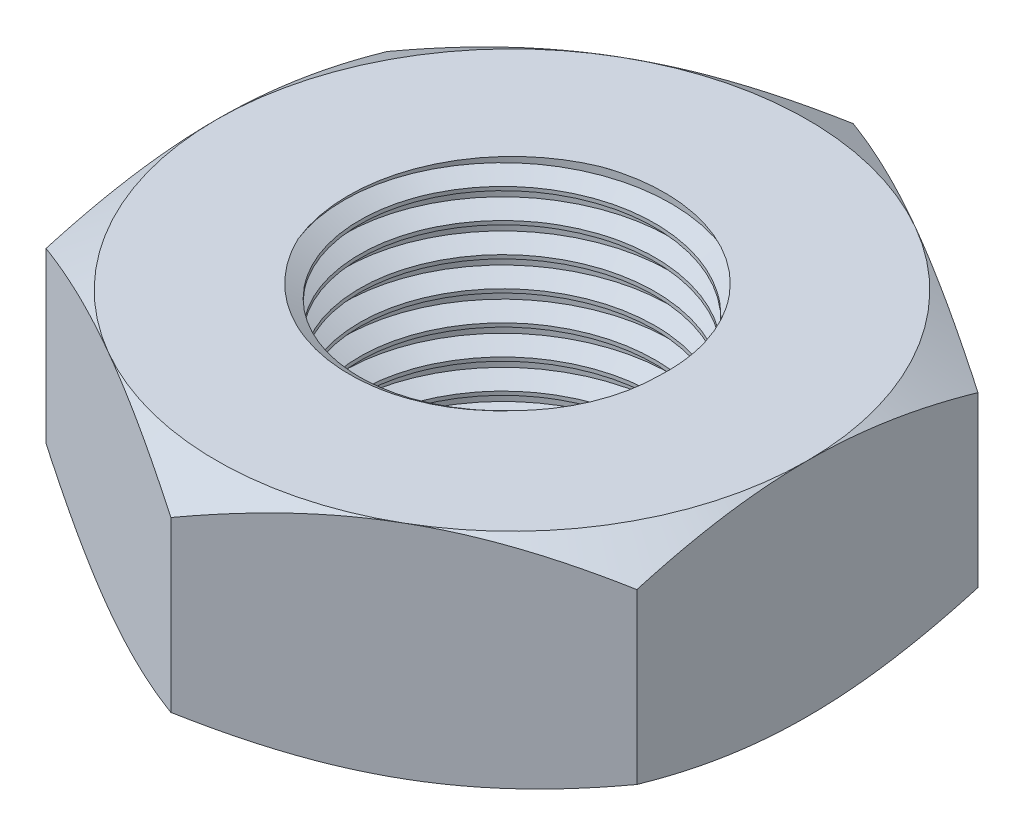
from build123d import *

# Parameters (mm, degrees)
SKETCH1_R                    = 10
BOSS_EXTRUDE1_DEPTH          = 7.5
THREAD1_PITCH                = 2
SKETCH5_OUTSIDE_W            = 175.946
SKETCH5_OUTSIDE_H            = 182.134
SKETCH5_OUTSIDE_R            = 20
CUT_EXTRUDE1_DEPTH           = 35.034296598
CUT_EXTRUDE1_TAPER           = 60
CUT_EXTRUDE1_OTHER_WAY_DEPTH = 35.034296598


with BuildPart() as part:
    # Sketch1 → Boss-Extrude1 (new, symmetric)
    with BuildSketch(Plane(origin=(0, 0, 0), x_dir=(1, 0, 0), z_dir=(0, 1, 0))):
        Polygon((0, 23.094010768), (-20, 11.547005384), (-20, -11.547005384), (0, -23.094010768), (20, -11.547005384), (20, 11.547005384), align=None)
        with Locations(Location((0, 0, 0), (0, 0, 270))):
            Circle(SKETCH1_R, mode=Mode.SUBTRACT)
    extrude(amount=BOSS_EXTRUDE1_DEPTH, both=True)

    # Thread1: the profile of Thread Profile1 profile screwed along a right-hand helix of 13.5 turns, 10 arcs to a turn; built about Z, then put on its axis
    thread1_z = Axis((0, 0, 0), (0, 0, 1))
    thread1_corners = [(9.9997, 0, -0.000173205), (9.9997, 0, 1.7501732), (11.08253175, 0, 1.124999997), (11.08253175, 0, 0.624999997)]
    with BuildLine(mode=Mode.PRIVATE) as thread1_profile:
        Line(thread1_corners[0], thread1_corners[1])
        Line(thread1_corners[1], thread1_corners[2])
        Line(thread1_corners[2], thread1_corners[3])
        Line(thread1_corners[3], thread1_corners[0])
    thread1_cap = Face(thread1_profile.wire())
    thread1_turn_angles = [0, 18, 36, 54, 72, 90, 108, 126, 144, 162, 180, 198, 216, 234, 252, 270, 288, 306, 324, 342, 360]
    thread1_turn_weights = [1, 0.9510565162951535, 1, 0.9510565162951535, 1, 0.9510565162951535, 1, 0.9510565162951535, 1, 0.9510565162951535, 1, 0.9510565162951535, 1, 0.9510565162951535, 1, 0.9510565162951535, 1, 0.9510565162951535, 1, 0.9510565162951535, 1]
    thread1_turn_rails = [Edge.make_bspline([Vector(p[0], p[1], 0).rotate(thread1_z, thread1_turn_angles[k]) / thread1_turn_weights[k] + Vector(0, 0, p[2] + THREAD1_PITCH * thread1_turn_angles[k] / 360) for k in range(21)], [0, 0, 0, 1, 1, 2, 2, 3, 3, 4, 4, 5, 5, 6, 6, 7, 7, 8, 8, 9, 9, 10, 10, 10], 2, thread1_turn_weights) for p in thread1_corners]
    thread1_turn_sides = [Face.make_surface_from_curves(thread1_turn_rails[p[0]], thread1_turn_rails[p[1]]) for p in [(0, 1), (1, 2), (2, 3), (3, 0)]]
    thread1_last_angles = [4680, 4698, 4716, 4734, 4752, 4770, 4788, 4806, 4824, 4842, 4860]
    thread1_last_weights = [1, 0.9510565162951535, 1, 0.9510565162951535, 1, 0.9510565162951535, 1, 0.9510565162951535, 1, 0.9510565162951511, 1]
    thread1_last_rails = [Edge.make_bspline([Vector(p[0], p[1], 0).rotate(thread1_z, thread1_last_angles[k]) / thread1_last_weights[k] + Vector(0, 0, p[2] + THREAD1_PITCH * thread1_last_angles[k] / 360) for k in range(11)], [0, 0, 0, 1, 1, 2, 2, 3, 3, 4, 4, 5, 5, 5], 2, thread1_last_weights) for p in thread1_corners]
    thread1_last_sides = [Face.make_surface_from_curves(thread1_last_rails[p[0]], thread1_last_rails[p[1]]) for p in [(0, 1), (1, 2), (2, 3), (3, 0)]]
    thread1 = Plane(origin=(0, 12.5, 0), x_dir=(-1, 0, 0), z_dir=(0, -1, 0)) * Solid(Shell([*[p.moved(Location((0, 0, THREAD1_PITCH * i))) for i in range(13) for p in thread1_turn_sides], *thread1_last_sides, thread1_cap, thread1_cap.rotate(thread1_z, 4860).moved(Location((0, 0, THREAD1_PITCH * 4860 / 360)))]))
    add(thread1, mode=Mode.SUBTRACT)

    # Sketch5 outside → Cut-Extrude1 (cut)
    with BuildSketch(Plane(origin=(0, 7.5, 0), x_dir=(1, 0, 0), z_dir=(0, 1, 0))):
        Rectangle(SKETCH5_OUTSIDE_W, SKETCH5_OUTSIDE_H)
        Circle(SKETCH5_OUTSIDE_R, mode=Mode.SUBTRACT)
    cut_extrude1 = extrude(amount=-CUT_EXTRUDE1_DEPTH, taper=CUT_EXTRUDE1_TAPER, mode=Mode.SUBTRACT)

    # Sketch5 outside → Cut-Extrude1 other way (cut)
    with BuildSketch(Plane(origin=(0, 7.5, 0), x_dir=(1, 0, 0), z_dir=(0, 1, 0))):
        Rectangle(SKETCH5_OUTSIDE_W, SKETCH5_OUTSIDE_H)
        Circle(SKETCH5_OUTSIDE_R, mode=Mode.SUBTRACT)
    extrude(amount=CUT_EXTRUDE1_OTHER_WAY_DEPTH, mode=Mode.SUBTRACT)

    # Mirror1: Cut-Extrude1 across plane
    add(cut_extrude1.mirror(Plane.ZX), mode=Mode.SUBTRACT)


solid = part.part
